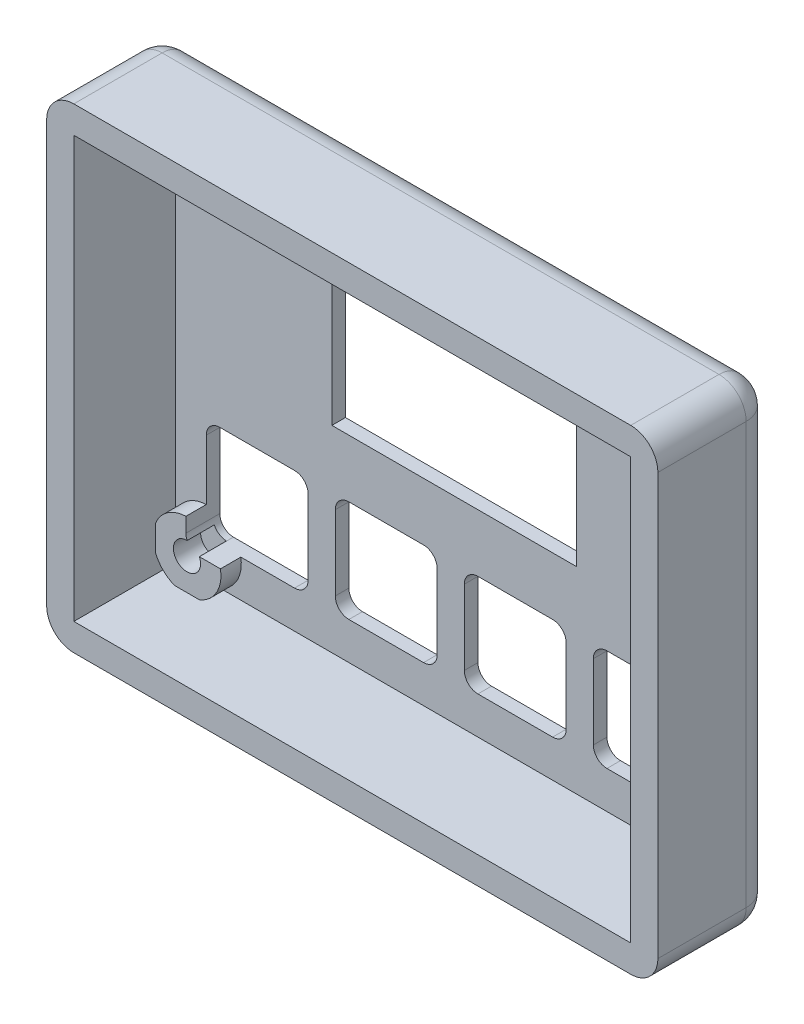
from build123d import *

# Parameters (mm, degrees)
SKETCH1_W           = 90
SKETCH1_H           = 70
BOSS_EXTRUDE1_DEPTH = 2
SKETCH3_W           = 90
SKETCH3_H           = 70
SKETCH3_W_2         = 82
SKETCH3_H_2         = 62
BOSS_EXTRUDE2_DEPTH = 15
FILLET1_R           = 4
SKETCH4_W           = 36
SKETCH4_H           = 24
CUT_EXTRUDE1_DEPTH  = 60.489494871
SKETCH2_R           = 5
BOSS_EXTRUDE3_DEPTH = 3
CUT_EXTRUDE2_DEPTH  = 18
SKETCH7_R           = 2
CUT_EXTRUDE3_DEPTH  = 4


with BuildPart() as part:
    # Sketch1 → Boss-Extrude1 (new body)
    with BuildSketch(Plane.XY):
        Rectangle(SKETCH1_W, SKETCH1_H)
    extrude(amount=BOSS_EXTRUDE1_DEPTH)

    # Sketch3 → Boss-Extrude2 (add)
    with BuildSketch(Plane.XY.offset(2)):
        Rectangle(SKETCH3_W, SKETCH3_H)
        Rectangle(SKETCH3_W_2, SKETCH3_H_2, mode=Mode.SUBTRACT)
    extrude(amount=BOSS_EXTRUDE2_DEPTH)

    # Fillet1
    fillet1_edges = [part.edges().sort_by_distance(p)[0] for p in [
        (45, -35, 8.5),
        (-45, 35, 8.5),
        (45, 35, 8.5),
        (-45, -35, 8.5),
        (0, 35, 0),
        (-45, 0, 0),
        (0, -35, 0),
        (45, 0, 0),
    ]]
    fillet(fillet1_edges, radius=FILLET1_R)

    # Sketch4 → Cut-Extrude1 (cut, through all)
    with BuildSketch(Plane(origin=(0, 0, 0), x_dir=(-1, 0, 0), z_dir=(0, 0, -1))):
        with Locations((0, 10)):
            Rectangle(SKETCH4_W, SKETCH4_H)
    extrude(amount=-CUT_EXTRUDE1_DEPTH, mode=Mode.SUBTRACT)

    # Sketch2 → Boss-Extrude3 (add)
    with BuildSketch(Plane.XY.offset(2)):
        with Locations((-36.34, 26.34)):
            Circle(SKETCH2_R)
        with Locations((36.34, 26.34)):
            Circle(SKETCH2_R)
        with Locations((-36.34, -26.34)):
            Circle(SKETCH2_R)
        with Locations((36.34, -26.34)):
            Circle(SKETCH2_R)
    extrude(amount=BOSS_EXTRUDE3_DEPTH)

    # Sketch6 → Cut-Extrude2 (cut)
    with BuildSketch(Plane(origin=(0, 0, 0), x_dir=(-1, 0, 0), z_dir=(0, 0, -1))):
        with BuildLine():
            Line((-33.5, -10.5), (-22.5, -10.5))
            ThreePointArc((-22.5, -10.5), (-21.085786438, -11.085786438), (-20.5, -12.5))
            Line((-20.5, -12.5), (-20.5, -23.5))
            ThreePointArc((-20.5, -23.5), (-21.085786438, -24.914213562), (-22.5, -25.5))
            Line((-22.5, -25.5), (-33.5, -25.5))
            ThreePointArc((-33.5, -25.5), (-34.914213562, -24.914213562), (-35.5, -23.5))
            Line((-35.5, -23.5), (-35.5, -12.5))
            ThreePointArc((-35.5, -12.5), (-34.914213562, -11.085786438), (-33.5, -10.5))
        make_face()
        with BuildLine():
            Line((-14.5, -10.5), (-3.5, -10.5))
            ThreePointArc((-3.5, -10.5), (-2.085786438, -11.085786438), (-1.5, -12.5))
            Line((-1.5, -12.5), (-1.5, -23.5))
            ThreePointArc((-1.5, -23.5), (-2.085786438, -24.914213562), (-3.5, -25.5))
            Line((-3.5, -25.5), (-14.5, -25.5))
            ThreePointArc((-14.5, -25.5), (-15.914213562, -24.914213562), (-16.5, -23.5))
            Line((-16.5, -23.5), (-16.5, -12.5))
            ThreePointArc((-16.5, -12.5), (-15.914213562, -11.085786438), (-14.5, -10.5))
        make_face()
        with BuildLine():
            Line((4.5, -10.5), (15.5, -10.5))
            ThreePointArc((15.5, -10.5), (16.914213562, -11.085786438), (17.5, -12.5))
            Line((17.5, -12.5), (17.5, -23.5))
            ThreePointArc((17.5, -23.5), (16.914213562, -24.914213562), (15.5, -25.5))
            Line((15.5, -25.5), (4.5, -25.5))
            ThreePointArc((4.5, -25.5), (3.085786438, -24.914213562), (2.5, -23.5))
            Line((2.5, -23.5), (2.5, -12.5))
            ThreePointArc((2.5, -12.5), (3.085786438, -11.085786438), (4.5, -10.5))
        make_face()
        with BuildLine():
            Line((23.5, -10.5), (34.5, -10.5))
            ThreePointArc((34.5, -10.5), (35.914213562, -11.085786438), (36.5, -12.5))
            Line((36.5, -12.5), (36.5, -23.5))
            ThreePointArc((36.5, -23.5), (35.914213562, -24.914213562), (34.5, -25.5))
            Line((34.5, -25.5), (23.5, -25.5))
            ThreePointArc((23.5, -25.5), (22.085786438, -24.914213562), (21.5, -23.5))
            Line((21.5, -23.5), (21.5, -12.5))
            ThreePointArc((21.5, -12.5), (22.085786438, -11.085786438), (23.5, -10.5))
        make_face()
    extrude(amount=-CUT_EXTRUDE2_DEPTH, mode=Mode.SUBTRACT)

    # Sketch7 → Cut-Extrude3 (cut)
    with BuildSketch(Plane.XY.offset(5)):
        with Locations((-36.34, 26.34)):
            Circle(SKETCH7_R)
        with Locations((36.34, 26.34)):
            Circle(SKETCH7_R)
        with Locations((36.34, -26.34)):
            Circle(SKETCH7_R)
        with Locations((-36.34, -26.34)):
            Circle(SKETCH7_R)
    extrude(amount=-CUT_EXTRUDE3_DEPTH, mode=Mode.SUBTRACT)


solid = part.part
